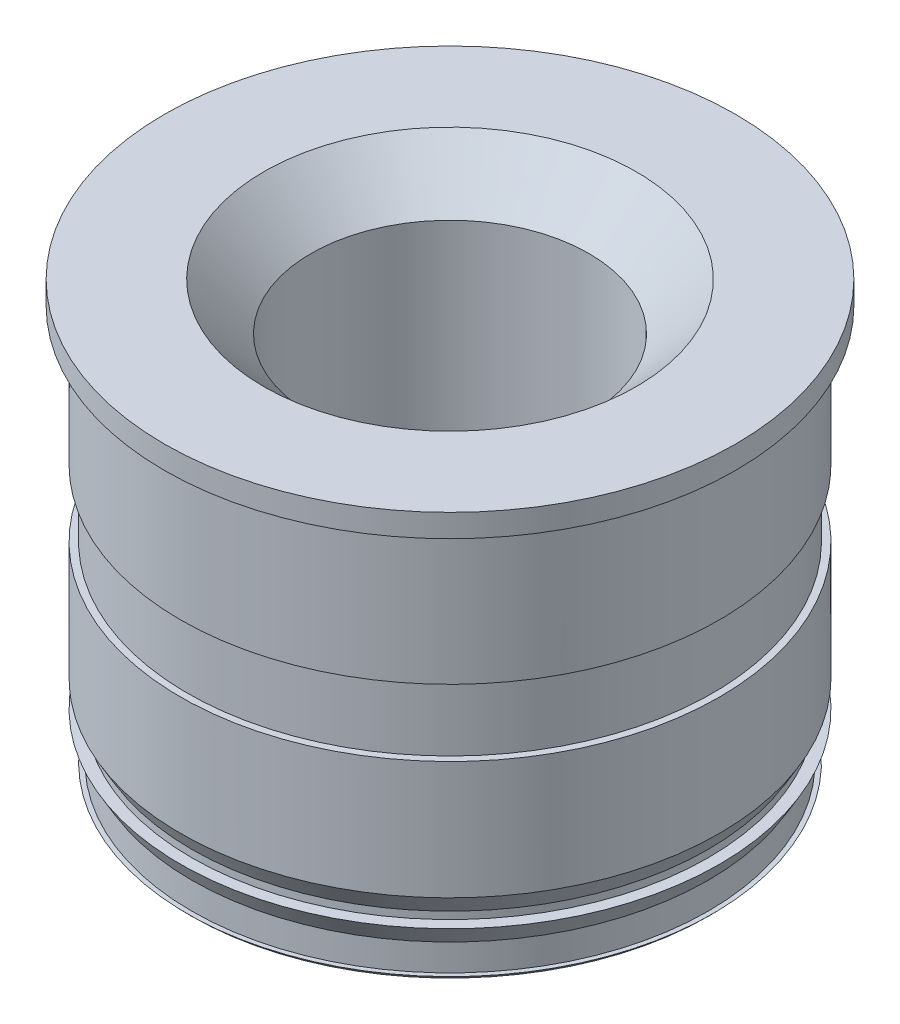
from build123d import *

# Parameters (mm, degrees)
SKETCH1_R      = 2.87
EXTRUDE1_DEPTH = 4.7
SKETCH1_4_R    = 2.995
EXTRUDE2_DEPTH = 3.838846
SKETCH1_3_R    = 3.175
EXTRUDE3_DEPTH = 0.254
SKETCH2_R      = 2.995
EXTRUDE4_DEPTH = 0.216506
EXTRUDE4_TAPER = 30
SKETCH8_R      = 1.545336663
EXTRUDE6_DEPTH = 4.7
CHAMFER1_SIZE  = 0.525
SKETCH11_W     = 0.255
SKETCH11_H     = 0.74295


# Read off the part's stored shape, not the designer's step: Extrude5
with BuildPart() as part:
    # Sketch1 → Extrude1 (new body)
    with BuildSketch(Plane(origin=(0, 0, 0), x_dir=(1, 0, 0), z_dir=(0, 1, 0))):
        with Locations(Location((0, 0, 0), (0, 0, 270))):
            Circle(SKETCH1_R)
    extrude(amount=-EXTRUDE1_DEPTH)

    # Sketch1<4> → Extrude2 (add)
    with BuildSketch(Plane(origin=(0, 0, 0), x_dir=(1, 0, 0), z_dir=(0, 1, 0))):
        with Locations(Location((0, 0, 0), (0, 0, 270))):
            Circle(SKETCH1_4_R)
    extrude(amount=-EXTRUDE2_DEPTH)

    # Sketch1<3> → Extrude3 (add)
    with BuildSketch(Plane(origin=(0, 0, 0), x_dir=(1, 0, 0), z_dir=(0, 1, 0))):
        with Locations(Location((0, 0, 0), (0, 0, 270))):
            Circle(SKETCH1_3_R)
    extrude(amount=-EXTRUDE3_DEPTH)

    # Sketch2 → Extrude4 (add)
    with BuildSketch(Plane.XZ.offset(3.838846189)):
        with Locations(Location((0, 0, 0), (0, 0, 90))):
            Circle(SKETCH2_R)
    extrude(amount=EXTRUDE4_DEPTH, taper=EXTRUDE4_TAPER)

    # Extrude5 outline → Extrude5 (revolve)
    with BuildSketch(Plane.XY):
        Polygon((2.87, -4.65), (2.87, -4.7), (2.92, -4.65), align=None)
    revolve(axis=Axis((0, 0, 0), (0, 1, 0)))

    # Sketch5 → Revolve1 (revolve)
    with BuildSketch(Plane.XY):
        Polygon((-2.87, -4.35267627), (-2.995, -4.136169919), (-2.87, -4.136169919), align=None)
    revolve(axis=Axis((0, 0, 0), (0, -1, 0)))

    # Sketch8 → Extrude6 (cut)
    with BuildSketch(Plane(origin=(0, 0, 0), x_dir=(1, 0, 0), z_dir=(0, 1, 0))):
        with Locations(Location((0, 0, 0), (0, 0, 270))):
            Circle(SKETCH8_R)
    extrude(amount=-EXTRUDE6_DEPTH, mode=Mode.SUBTRACT)

    # Chamfer1
    chamfer1_edges = [part.edges().sort_by_distance(p)[0] for p in [
        (0, -4.7, -1.545336663),
        (0, 0, -1.545336663),
    ]]
    chamfer(chamfer1_edges, length=CHAMFER1_SIZE)

    # Sketch11 → Cut-Revolve1 (revolve, cut)
    with BuildSketch(Plane.XY):
        with Locations((-3.0475, -2.15467627)):
            Rectangle(SKETCH11_W, SKETCH11_H)
    revolve(axis=Axis((0, 0, 0), (0, -1, 0)), mode=Mode.SUBTRACT)


solid = part.part
